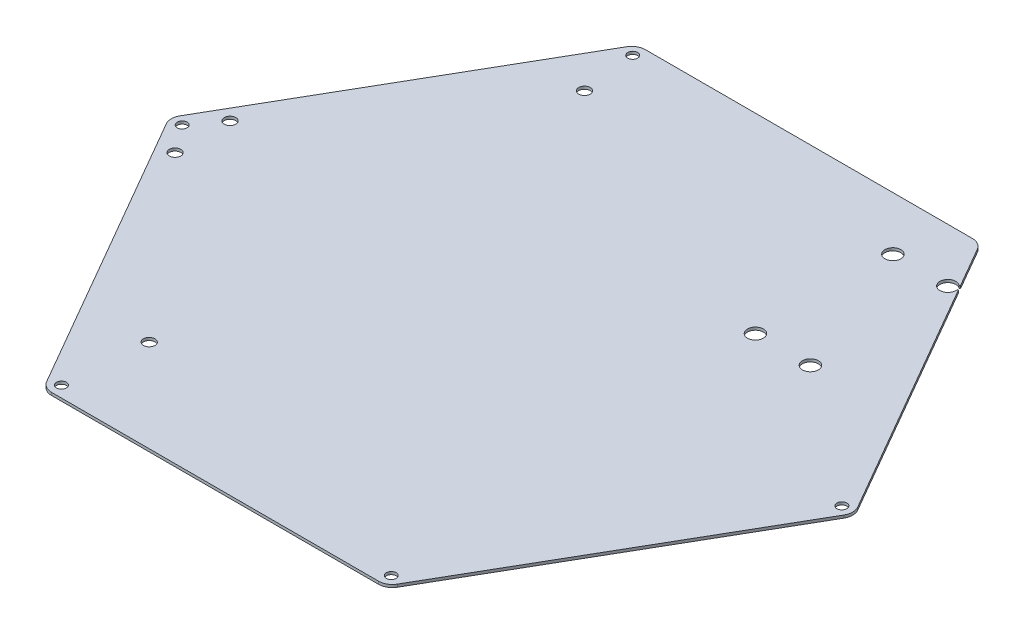
from build123d import *

# Parameters (mm, degrees)
BOSS_EXTRUDE1_DEPTH      = 1
FILLET1_R                = 5
M5_CLEARANCE_HOLE1_D     = 5.8
M5_CLEARANCE_HOLE1_DEPTH = 5
M5_CLEARANCE_HOLE1_TIP   = 1.742495795
M3_CLEARANCE_HOLE1_D     = 3.6
CUT_EXTRUDE1_DEPTH       = 330.362644314
SKETCH10_R               = 2.1
CUT_EXTRUDE2_DEPTH       = 330.362644314


with BuildPart() as part:
    # Sketch1 → Boss-Extrude1 (new body)
    with BuildSketch(Plane(origin=(0, 0, 0), x_dir=(1, 0, 0), z_dir=(0, 1, 0))):
        Polygon((62.353829072, 0), (187.061487217, 0), (249.41531629, 108), (187.061487217, 216), (62.353829072, 216), (0, 108), align=None)
    extrude(amount=BOSS_EXTRUDE1_DEPTH)

    # Fillet1
    fillet1_edges = [part.edges().sort_by_distance(p)[0] for p in [
        (0, 0.5, -108),
        (62.353829072, 0.5, -216),
        (187.061487217, 0.5, -216),
        (249.41531629, 0.5, -108),
        (62.353829072, 0.5, 0),
        (187.061487217, 0.5, 0),
    ]]
    fillet(fillet1_edges, radius=FILLET1_R)

    # M5 Clearance Hole1
    with Locations(Plane(origin=(0, 1, 0), x_dir=(1, 0, 0), z_dir=(0, 1, 0))):
        with Locations((174.707658145, 146.57), (194.707658145, 146.57), (194.707658145, 196.57), (174.707658145, 196.57)):
            Hole(M5_CLEARANCE_HOLE1_D / 2, depth=M5_CLEARANCE_HOLE1_DEPTH)
            with Locations((0, 0, -(M5_CLEARANCE_HOLE1_DEPTH + M5_CLEARANCE_HOLE1_TIP / 2))):  # 118° drill point
                Cone(0, M5_CLEARANCE_HOLE1_D / 2, M5_CLEARANCE_HOLE1_TIP, mode=Mode.SUBTRACT)

    # M3 Clearance Hole1 (through all)
    with Locations(Plane(origin=(0, 1, 0), x_dir=(1, 0, 0), z_dir=(0, 1, 0))):
        with Locations((4.707658145, 108), (64.707658145, 211.923048454), (244.707658145, 108), (184.707658145, 4.076951546), (64.707658145, 4.076951546)):
            Hole(M3_CLEARANCE_HOLE1_D / 2)

    # Sketch9 → Cut-Extrude1 (cut, through all)
    with BuildSketch(Plane(origin=(0, 1, 0), x_dir=(1, 0, 0), z_dir=(0, 1, 0))):
        Polygon((196.564025782, 198.797980968), (196.885814598, 198.983765827), (197.887118897, 197.249455908), (197.565330081, 197.063671049), align=None)
    extrude(amount=-CUT_EXTRUDE1_DEPTH, mode=Mode.SUBTRACT)

    # Sketch10 → Cut-Extrude2 (cut, through all)
    with BuildSketch(Plane(origin=(0, 1, 0), x_dir=(1, 0, 0), z_dir=(0, 1, 0))):
        with Locations((12.124355653, 118)):
            Circle(SKETCH10_R)
        with Locations((12.124355653, 98)):
            Circle(SKETCH10_R)
        with Locations((67.124355653, 33.59005507)):
            Circle(SKETCH10_R)
        with Locations((67.124355653, 191.960479734)):
            Circle(SKETCH10_R)
    extrude(amount=-CUT_EXTRUDE2_DEPTH, mode=Mode.SUBTRACT)


solid = part.part
